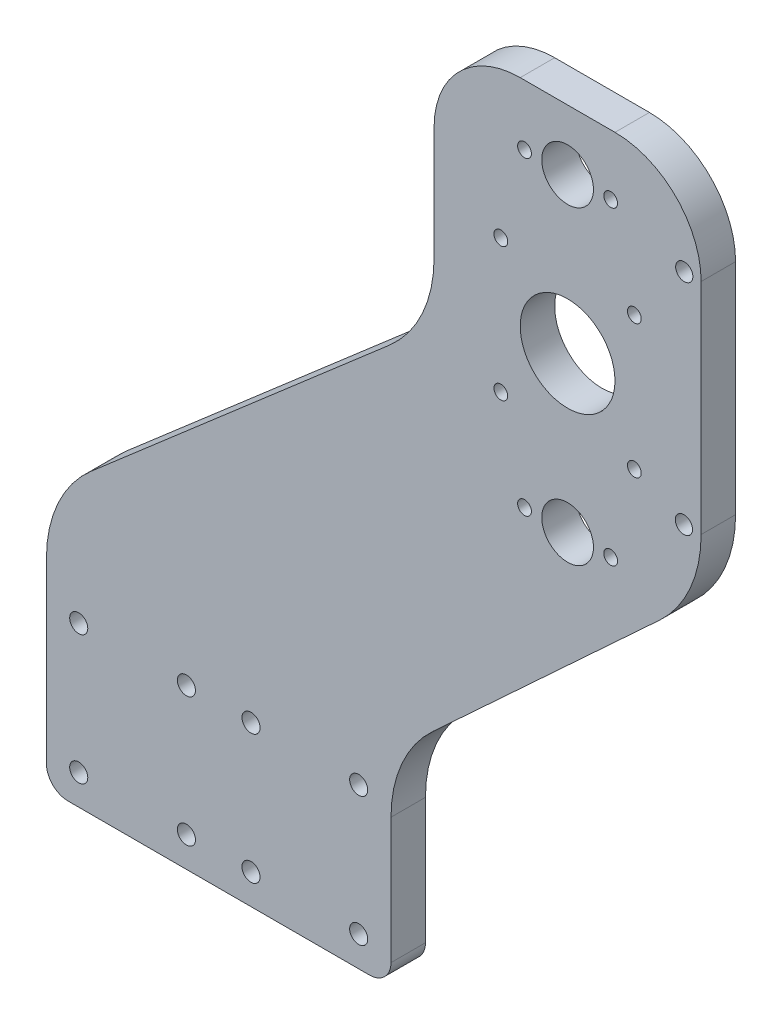
from build123d import *

# Parameters (mm, degrees)
SKETCH1_R           = 2.1
SKETCH1_R_2         = 6
SKETCH1_R_3         = 11
SKETCH1_R_4         = 1.6
SKETCH1_R_5         = 2
BOSS_EXTRUDE1_DEPTH = 8


with BuildPart() as part:
    # Sketch1 → Boss-Extrude1 (new body)
    with BuildSketch(Plane.XY):
        with BuildLine():
            Line((-58.731017158, -89.445111827), (11.268982842, -89.445111827))
            ThreePointArc((11.268982842, -89.445111827), (14.804516748, -87.980645733), (16.268982842, -84.445111827))
            Line((16.268982842, -84.445111827), (16.268982842, -55.206132823))
            ThreePointArc((16.268982842, -55.206132823), (18.781371957, -43.188177597), (25.897732696, -33.18314103))
            Line((25.897732696, -33.18314103), (78.640232988, 15.603630397))
            ThreePointArc((78.640232988, 15.603630397), (85.756593727, 25.608666964), (88.268982842, 37.62662219))
            Line((88.268982842, 37.62662219), (88.268982842, 88.499564037))
            ThreePointArc((88.268982842, 88.499564037), (82.411118466, 102.641699661), (68.268982842, 108.499564037))
            Line((68.268982842, 108.499564037), (46.268982842, 108.499564037))
            ThreePointArc((46.268982842, 108.499564037), (32.126847218, 102.641699661), (26.268982842, 88.499564037))
            Line((26.268982842, 88.499564037), (26.268982842, 62.204796523))
            ThreePointArc((26.268982842, 62.204796523), (23.556329958, 49.738815318), (15.908937016, 39.527226105))
            Line((15.908937016, 39.527226105), (-53.370971331, -20.472773895))
            ThreePointArc((-53.370971331, -20.472773895), (-61.018364273, -30.684363108), (-63.731017158, -43.150344313))
            Line((-63.731017158, -43.150344313), (-63.731017158, -84.445111827))
            ThreePointArc((-63.731017158, -84.445111827), (-62.266551064, -87.980645733), (-58.731017158, -89.445111827))
        make_face()
        with Locations((-56.231017158, -52.445111827)):
            Circle(SKETCH1_R, mode=Mode.SUBTRACT)
        with Locations((-31.231017158, -52.445111827)):
            Circle(SKETCH1_R, mode=Mode.SUBTRACT)
        with Locations((-31.231017158, -82.445111827)):
            Circle(SKETCH1_R, mode=Mode.SUBTRACT)
        with Locations((-56.231017158, -82.445111827)):
            Circle(SKETCH1_R, mode=Mode.SUBTRACT)
        with Locations((8.768982842, -82.445111827)):
            Circle(SKETCH1_R, mode=Mode.SUBTRACT)
        with Locations((-16.231017158, -82.445111827)):
            Circle(SKETCH1_R, mode=Mode.SUBTRACT)
        with Locations((-16.231017158, -52.445111827)):
            Circle(SKETCH1_R, mode=Mode.SUBTRACT)
        with Locations((8.768982842, -52.445111827)):
            Circle(SKETCH1_R, mode=Mode.SUBTRACT)
        with Locations((57.268982842, 94.499564037)):
            Circle(SKETCH1_R_2, mode=Mode.SUBTRACT)
        with Locations((57.268982842, 22.559564037)):
            Circle(SKETCH1_R_2, mode=Mode.SUBTRACT)
        with Locations((57.268982842, 58.529564037)):
            Circle(SKETCH1_R_3, mode=Mode.SUBTRACT)
        with Locations((41.768982842, 74.029564037)):
            Circle(SKETCH1_R_4, mode=Mode.SUBTRACT)
        with Locations((72.768982842, 74.029564037)):
            Circle(SKETCH1_R_4, mode=Mode.SUBTRACT)
        with Locations((72.768982842, 43.029564037)):
            Circle(SKETCH1_R_4, mode=Mode.SUBTRACT)
        with Locations((41.768982842, 43.029564037)):
            Circle(SKETCH1_R_4, mode=Mode.SUBTRACT)
        with Locations((84.268982842, 37.62662219)):
            Circle(SKETCH1_R_5, mode=Mode.SUBTRACT)
        with Locations((84.351781192, 88.518513838)):
            Circle(SKETCH1_R_5, mode=Mode.SUBTRACT)
        with Locations((47.268982842, 94.499564037)):
            Circle(SKETCH1_R_4, mode=Mode.SUBTRACT)
        with Locations((47.268982842, 22.559564037)):
            Circle(SKETCH1_R_4, mode=Mode.SUBTRACT)
        with Locations((67.268982842, 94.499564037)):
            Circle(SKETCH1_R_4, mode=Mode.SUBTRACT)
        with Locations((67.268982842, 22.559564037)):
            Circle(SKETCH1_R_4, mode=Mode.SUBTRACT)
    extrude(amount=BOSS_EXTRUDE1_DEPTH)


solid = part.part
